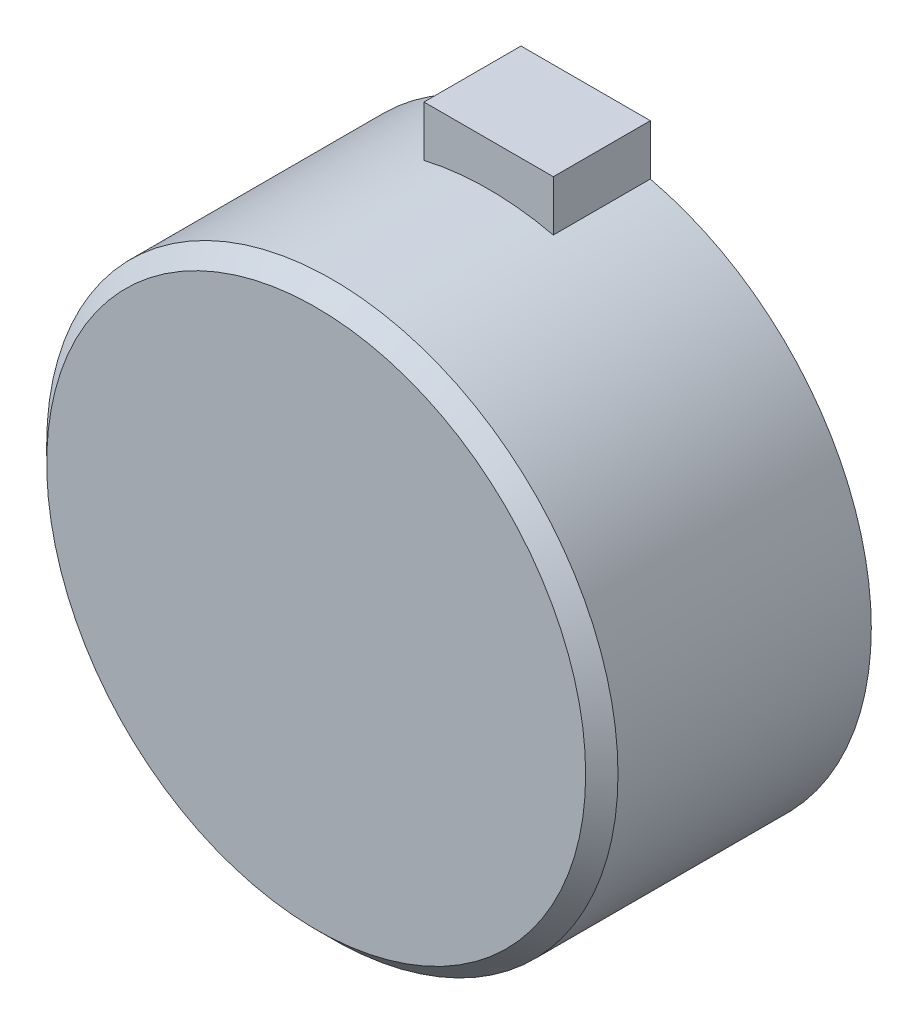
from build123d import *

# Parameters (mm, degrees)
SK_REARHOLE_R           = 1.65
REAR_TAPPED_HOLE_DEPTH  = 8
REAR_HOLE_PATTERN_COUNT = 8
SK_CONNECTOR_W          = 24
SK_CONNECTOR_H          = 12
CONNECTOR_ZONE_DEPTH    = 18


with BuildPart() as part:
    # SK_Body → Housing_Body (revolve)
    with BuildSketch(Plane(origin=(0, 0, 0), x_dir=(1, 0, 0), z_dir=(0, 1, 0))):
        Polygon((0, 0), (50, 0), (53, 3), (53, 50), (50, 50), (0, 50), align=None)
    revolve(axis=Axis((0, 0, 10), (0, 0, -1)))

    # SK_RearHole → Rear_Tapped_Hole (cut)
    with BuildSketch(Plane.XY.offset(-50)):
        with Locations((43, 0)):
            Circle(SK_REARHOLE_R)
    rear_tapped_hole = extrude(amount=REAR_TAPPED_HOLE_DEPTH, mode=Mode.SUBTRACT)

    # Rear_Hole_Pattern: Rear_Tapped_Hole ×8 about axis
    rear_hole_pattern_axis = Axis((0, 0, -52.5), (0, 0, 1))
    for i in range(1, REAR_HOLE_PATTERN_COUNT):
        add(rear_tapped_hole.rotate(rear_hole_pattern_axis, i * 360 / REAR_HOLE_PATTERN_COUNT), mode=Mode.SUBTRACT)

    # SK_Connector → Connector_Zone (add)
    with BuildSketch(Plane.XY.offset(-50)):
        with Locations((0, 55)):
            Rectangle(SK_CONNECTOR_W, SK_CONNECTOR_H)
    extrude(amount=CONNECTOR_ZONE_DEPTH)


solid = part.part
